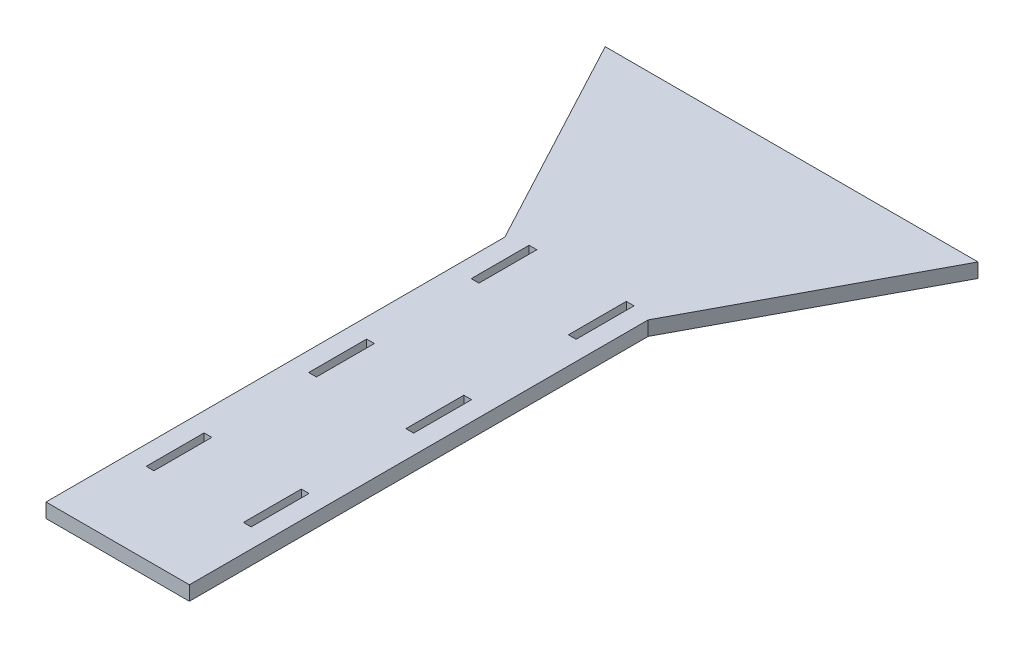
from build123d import *

# Parameters (mm, degrees)
BOSS_EXTRUDE1_DEPTH = 6.35
SKETCH2_W           = 3.429
SKETCH2_H           = 25.654
CUT_EXTRUDE1_DEPTH  = 310.721209316


with BuildPart() as part:
    # Sketch1 → Boss-Extrude1 (new body)
    with BuildSketch(Plane(origin=(0, 0, 0), x_dir=(1, 0, 0), z_dir=(0, 1, 0))):
        Polygon((-31.75, 0), (31.75, 0), (31.75, 203.2), (82.55, 298.45), (-82.55, 298.45), (-31.75, 203.2), align=None)
    extrude(amount=BOSS_EXTRUDE1_DEPTH)

    # Sketch2 → Cut-Extrude1 (cut, through all)
    with BuildSketch(Plane(origin=(0, 6.35, 0), x_dir=(1, 0, 0), z_dir=(0, 1, 0))):
        with Locations((-21.5265, 48.683333333)):
            Rectangle(SKETCH2_W, SKETCH2_H)
        with Locations((-21.5265, 120.65)):
            Rectangle(SKETCH2_W, SKETCH2_H)
        with Locations((-21.5265, 192.616666667)):
            Rectangle(SKETCH2_W, SKETCH2_H)
        with Locations((21.5265, 192.616666667)):
            Rectangle(SKETCH2_W, SKETCH2_H)
        with Locations((21.5265, 120.65)):
            Rectangle(SKETCH2_W, SKETCH2_H)
        with Locations((21.5265, 48.683333333)):
            Rectangle(SKETCH2_W, SKETCH2_H)
    extrude(amount=-CUT_EXTRUDE1_DEPTH, mode=Mode.SUBTRACT)


solid = part.part
